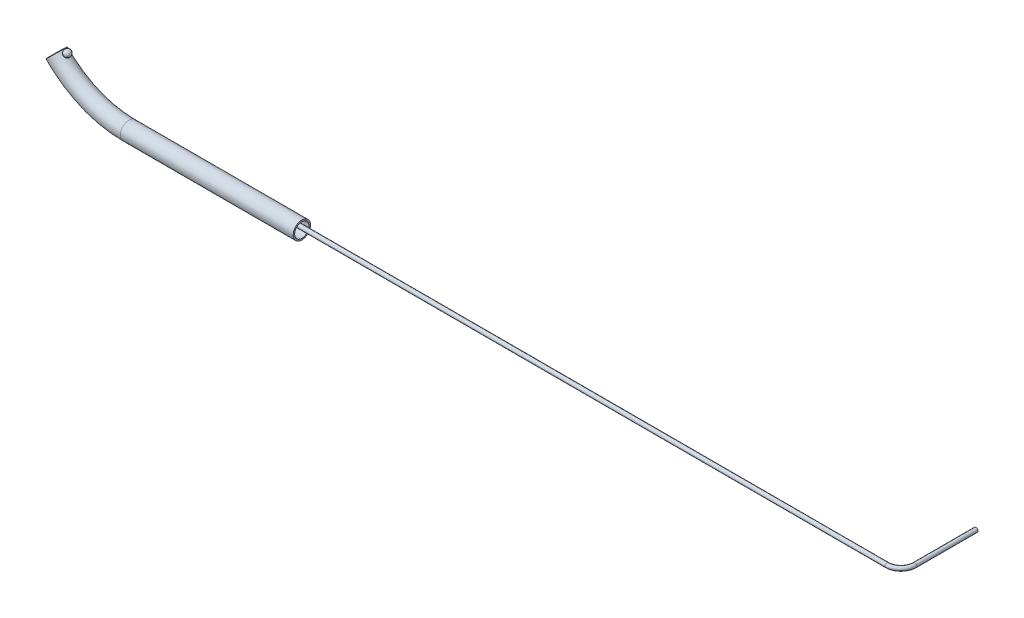
from build123d import *

# Parameters (mm, degrees)
SKETCH5_R           = 0.6223
SKETCH5_R_2         = 0.51435
SKETCH5_2_R         = 0.6223
SKETCH5_2_R_2       = 0.51435
BOSS_EXTRUDE2_DEPTH = 10
SKETCH8_R           = 0.15
SKETCH9_R           = 0.15
BOSS_EXTRUDE3_DEPTH = 40
SKETCH11_R          = 0.15


with BuildPart() as part:
    # Sweep2: sweep along a path in Sketch4
    with BuildLine(Plane.XY) as sweep2_path:
        Line((-65.954222951, 0), (-68.364968213, 0))
        ThreePointArc((-68.364968213, 0), (-71.186123393, 0.579815367), (-73.549932813, 2.225265895))
    # Sketch5 → Sweep2 (sweep)
    with BuildSketch(Plane(origin=(-65.954222951, 0, 0), x_dir=(0, 0, -1), z_dir=(1, 0, 0))):
        Circle(SKETCH5_R)
        Circle(SKETCH5_R_2, mode=Mode.SUBTRACT)
    sweep(path=sweep2_path.line)

    # Sketch5<2> → Boss-Extrude2 (add)
    with BuildSketch(Plane(origin=(-65.954222951, 0, 0), x_dir=(0, 0, -1), z_dir=(1, 0, 0))):
        Circle(SKETCH5_2_R)
        Circle(SKETCH5_2_R_2, mode=Mode.SUBTRACT)
    extrude(amount=BOSS_EXTRUDE2_DEPTH)

    # Sketch6 → Revolve2 (revolve)
    with BuildSketch(Plane.XY):
        with BuildLine():
            Line((-72.949063517, 2.38792888), (-72.625665662, 2.76926053))
            ThreePointArc((-72.625665662, 2.76926053), (-72.596698765, 2.416895777), (-72.949063517, 2.38792888))
        make_face()
    revolve(axis=Axis((-72.949063517, 2.38792888, 0), (0.6467957105420484, 0.7626632997754689, 0)))


with BuildPart() as body_2:
    # Sweep3: sweep along a path in Sketch7
    with BuildLine(Plane.XY) as sweep3_path:
        Line((-55.954222951, 0.1777), (-68.364968213, 0.1777))
        ThreePointArc((-68.364968213, 0.1777), (-71.116040444, 0.743111633), (-73.421128268, 2.347685988))
    # Sketch8 → Sweep3 (sweep)
    with BuildSketch(Plane(origin=(-36.018221468, 37.89664365, 0), x_dir=(0.7248426853938525, 0.688914422429251, 0), z_dir=(-0.688914422429251, 0.7248426853938525, 0))):
        with Locations((-51.601413042, 0)):
            Circle(SKETCH8_R)
    sweep(path=sweep3_path.line)

    # Sketch9 → Boss-Extrude3 (add)
    with BuildSketch(Plane(origin=(-55.954222951, 0, 0), x_dir=(0, 0, -1), z_dir=(1, 0, 0))):
        with Locations((0, 0.1777)):
            Circle(SKETCH9_R)
    extrude(amount=BOSS_EXTRUDE3_DEPTH)

    # Sweep4: sweep along a path in Sketch10
    with BuildLine(Plane(origin=(-32.524934282, 0.1777, -2.743586274), x_dir=(1, 0, 0), z_dir=(0, -1, 0))) as sweep4_path:
        Line((16.570711331, 2.743586274), (18.570711331, 2.743586274))
        ThreePointArc((18.570711331, 2.743586274), (19.277818112, 2.450693055), (19.570711331, 1.743586274))
        Line((19.570711331, 1.743586274), (19.570711331, -2.637865197))
    # Sketch11 → Sweep4 (sweep)
    with BuildSketch(Plane(origin=(-15.954222951, 0, 0), x_dir=(0, 0, -1), z_dir=(1, 0, 0))):
        with Locations((0, 0.1777)):
            Circle(SKETCH11_R)
    sweep(path=sweep4_path.line)


solid = Compound([part.part, body_2.part])
